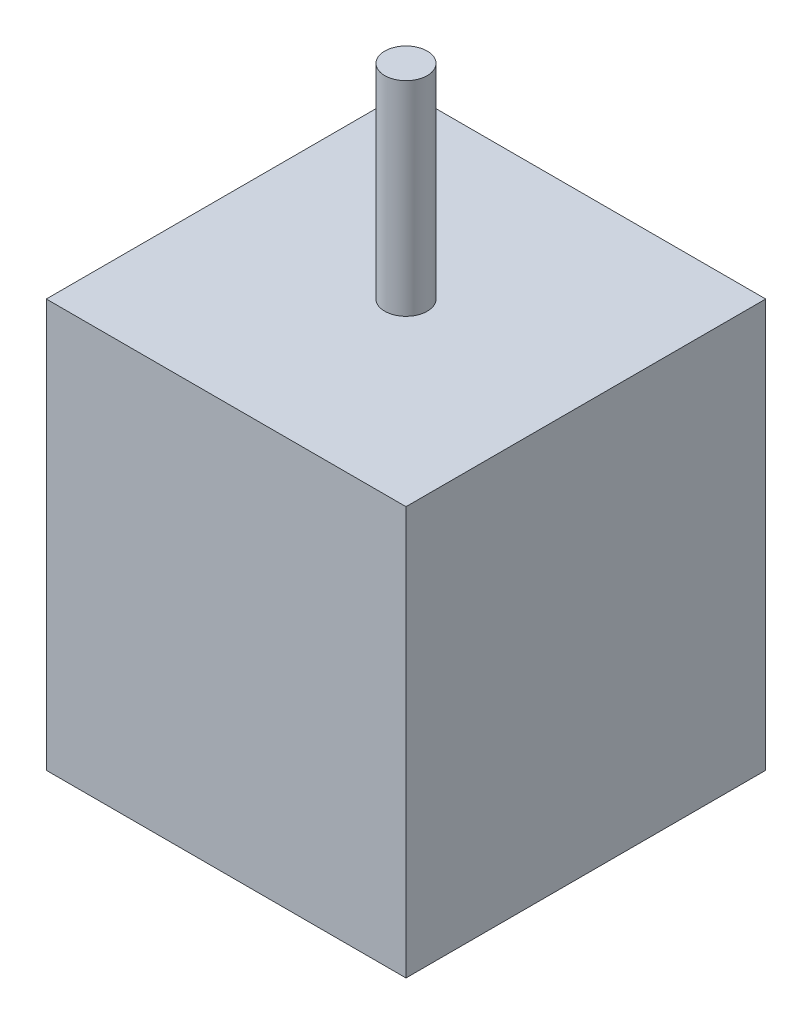
from build123d import *

# Parameters (mm, degrees)
SKETCH2_R           = 2.5
BOSS_EXTRUDE1_DEPTH = 24
SKETCH1_W           = 42.3
SKETCH1_H           = 42.3
BOSS_EXTRUDE2_DEPTH = 48


with BuildPart() as part:
    # Sketch2 → Boss-Extrude1 (new body)
    with BuildSketch(Plane(origin=(0, 0, 0), x_dir=(1, 0, 0), z_dir=(0, 1, 0))):
        Circle(SKETCH2_R)
    extrude(amount=BOSS_EXTRUDE1_DEPTH)

    # Sketch1 → Boss-Extrude2 (add)
    with BuildSketch(Plane(origin=(0, 0, 0), x_dir=(1, 0, 0), z_dir=(0, 1, 0))):
        Rectangle(SKETCH1_W, SKETCH1_H)
    extrude(amount=-BOSS_EXTRUDE2_DEPTH)


solid = part.part
